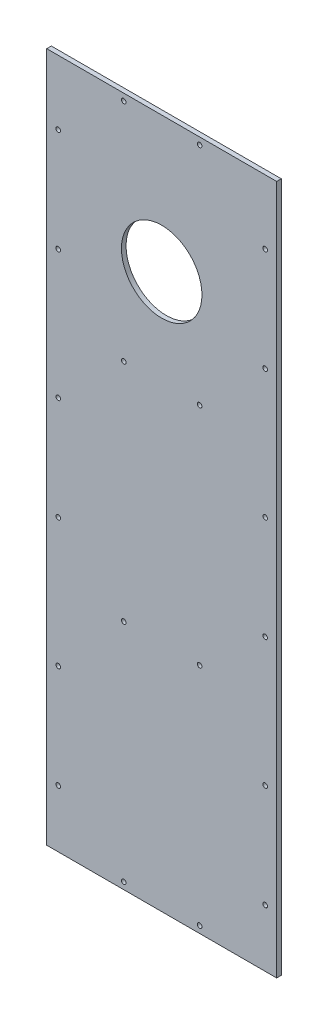
from build123d import *

# Parameters (mm, degrees)
SKETCH1_W           = 100
SKETCH1_H           = 300
BOSS_EXTRUDE1_DEPTH = 2
SKETCH2_R           = 1
CUT_EXTRUDE1_DEPTH  = 10
SKETCH3_R           = 17.5
CUT_EXTRUDE2_DEPTH  = 10


with BuildPart() as part:
    # Sketch1 → Boss-Extrude1 (new body)
    with BuildSketch(Plane.XY):
        Rectangle(SKETCH1_W, SKETCH1_H)
    extrude(amount=BOSS_EXTRUDE1_DEPTH)

    # Sketch2 → Cut-Extrude1 (cut)
    with BuildSketch(Plane.XY.offset(2)):
        with Locations((-45, 122)):
            Circle(SKETCH2_R)
        with Locations((-45, 77)):
            Circle(SKETCH2_R)
        with Locations((45, 122)):
            Circle(SKETCH2_R)
        with Locations((45, 77)):
            Circle(SKETCH2_R)
        with Locations((-45, 21)):
            Circle(SKETCH2_R)
        with Locations((-45, -24)):
            Circle(SKETCH2_R)
        with Locations((45, 21)):
            Circle(SKETCH2_R)
        with Locations((45, -24)):
            Circle(SKETCH2_R)
        with Locations((-45, -80)):
            Circle(SKETCH2_R)
        with Locations((-45, -125)):
            Circle(SKETCH2_R)
        with Locations((45, -80)):
            Circle(SKETCH2_R)
        with Locations((45, -125)):
            Circle(SKETCH2_R)
        with Locations((16.5, -147)):
            Circle(SKETCH2_R)
        with Locations((-16.5, -147)):
            Circle(SKETCH2_R)
        with Locations((-16.5, -49)):
            Circle(SKETCH2_R)
        with Locations((16.5, -49)):
            Circle(SKETCH2_R)
        with Locations((-16.5, 49)):
            Circle(SKETCH2_R)
        with Locations((16.5, 49)):
            Circle(SKETCH2_R)
        with Locations((-16.5, 147)):
            Circle(SKETCH2_R)
        with Locations((16.5, 147)):
            Circle(SKETCH2_R)
    extrude(amount=-CUT_EXTRUDE1_DEPTH, mode=Mode.SUBTRACT)

    # Sketch3 → Cut-Extrude2 (cut)
    with BuildSketch(Plane(origin=(0, 0, 0), x_dir=(-1, 0, 0), z_dir=(0, 0, -1))):
        with Locations((0, 91)):
            Circle(SKETCH3_R)
    extrude(amount=-CUT_EXTRUDE2_DEPTH, mode=Mode.SUBTRACT)


solid = part.part
